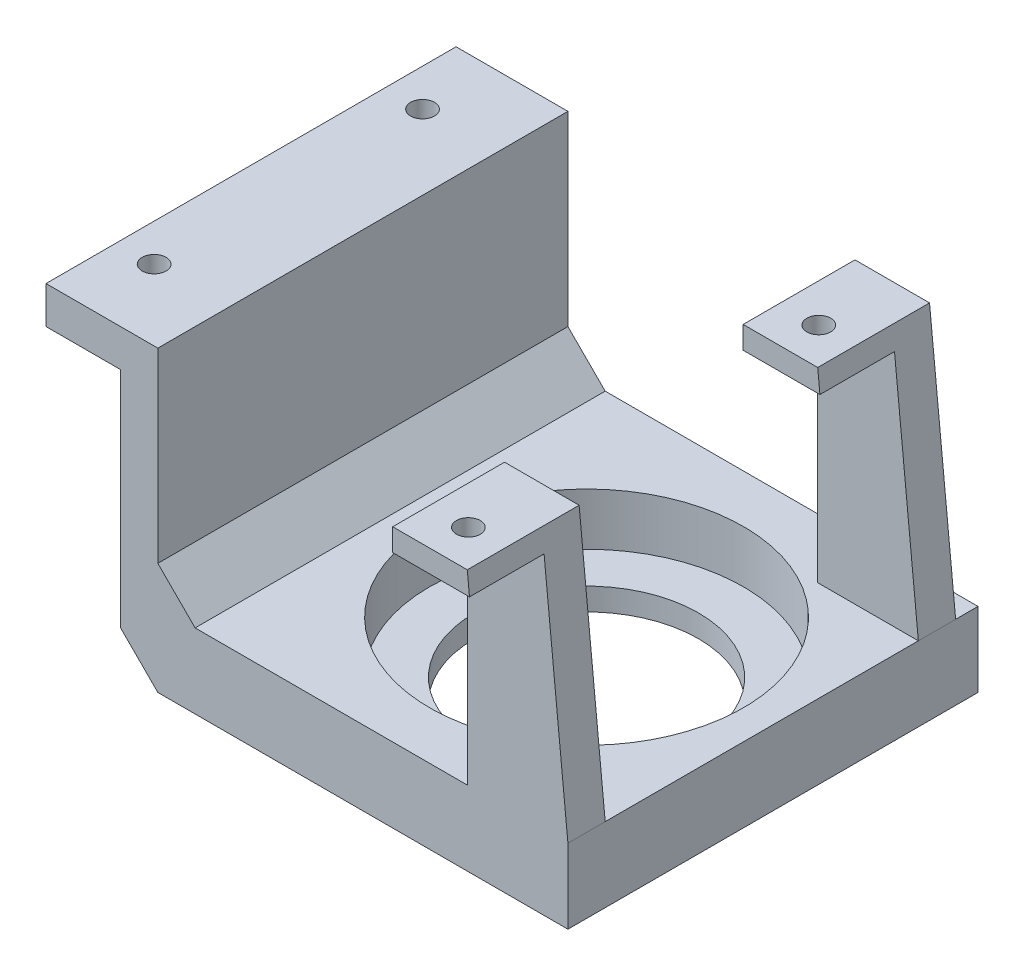
from build123d import *

# Parameters (mm, degrees)
SALIENTE_EXTRUIR2_DEPTH    = 55
CROQUIS6_R                 = 21.05
CORTAR_EXTRUIR1_DEPTH      = 7
CORTAR_EXTRUIR2_DEPTH      = 78.420927403
CORTAR_EXTRUIR2_DEPTH_BACK = 78.420927403
CROQUIS8_R                 = 15
CORTAR_EXTRUIR3_DEPTH      = 77.485292704
CORTAR_EXTRUIR3_DEPTH_BACK = 77.485292704
CROQUIS9_R                 = 1.6
CHAFL_N1_SIZE              = 5
CROQUIS11_W                = 10
CROQUIS11_H                = 5
SALIENTE_EXTRUIR3_DEPTH    = 35
CROQUIS13_W                = 10
CROQUIS13_H                = 5
SALIENTE_EXTRUIR5_DEPTH    = 35
SALIENTE_EXTRUIR7_DEPTH    = 5
SALIENTE_EXTRUIR8_DEPTH    = 5
SALIENTE_EXTRUIR9_DEPTH    = 10
SALIENTE_EXTRUIR10_DEPTH   = 10
CROQUIS15_R                = 1.6
CORTAR_EXTRUIR4_DEPTH      = 88.114866699


with BuildPart() as part:
    # Croquis4 → Saliente-Extruir2 (new body)
    with BuildSketch(Plane.XY):
        Polygon((-30, 5), (-30, 30), (-40, 30), (-40, 35), (-25, 35), (-25, 5), (30, 5), (30, -5), (-30, -5), align=None)
    extrude(amount=SALIENTE_EXTRUIR2_DEPTH)

    # Croquis6 → Cortar-Extruir1 (cut)
    with BuildSketch(Plane(origin=(0, 5, 0), x_dir=(1, 0, 0), z_dir=(0, 1, 0))):
        with Locations((5, -27.5)):
            Circle(CROQUIS6_R)
    extrude(amount=-CORTAR_EXTRUIR1_DEPTH, mode=Mode.SUBTRACT)

    # Croquis8 → Cortar-Extruir2 (cut, two sides: drawn at the far end of the back side and taken through both)
    with BuildSketch(Plane(origin=(0, -2, 0), x_dir=(1, 0, 0), z_dir=(0, 1, 0)).offset(-CORTAR_EXTRUIR2_DEPTH_BACK)):
        with Locations((5, -27.5)):
            Circle(CROQUIS8_R)
    extrude(amount=CORTAR_EXTRUIR2_DEPTH + CORTAR_EXTRUIR2_DEPTH_BACK, mode=Mode.SUBTRACT)

    # Croquis9 → Cortar-Extruir3 (cut, two sides: drawn at the far end of the back side and taken through both)
    with BuildSketch(Plane.XZ.offset(-30).offset(-CORTAR_EXTRUIR3_DEPTH_BACK)):
        with Locations((-35, 45.5)):
            Circle(CROQUIS9_R)
        with Locations((-35, 9.5)):
            Circle(CROQUIS9_R)
    extrude(amount=CORTAR_EXTRUIR3_DEPTH + CORTAR_EXTRUIR3_DEPTH_BACK, mode=Mode.SUBTRACT)

    # Chaflán1
    chafl_n1_edges = [part.edges().sort_by_distance(p)[0] for p in [
        (-25, 5, 27.5),
        (-30, -5, 27.5),
    ]]
    chamfer(chafl_n1_edges, length=CHAFL_N1_SIZE)

    # Croquis11 → Saliente-Extruir3 (add)
    with BuildSketch(Plane(origin=(0, 5, 0), x_dir=(1, 0, 0), z_dir=(0, 1, 0))):
        with Locations((21.5, -52.5)):
            Rectangle(CROQUIS11_W, CROQUIS11_H)
    extrude(amount=SALIENTE_EXTRUIR3_DEPTH)

    # Croquis13 → Saliente-Extruir5 (add)
    with BuildSketch(Plane(origin=(0, 5, 0), x_dir=(1, 0, 0), z_dir=(0, 1, 0))):
        with Locations((21.5, -5.5)):
            Rectangle(CROQUIS13_W, CROQUIS13_H)
    extrude(amount=SALIENTE_EXTRUIR5_DEPTH)

    # Croquis16 → Saliente-Extruir7 (add)
    with BuildSketch(Plane.XY.offset(55)):
        Polygon((30, 5), (26.5, 40), (26.5, 5), align=None)
    extrude(amount=-SALIENTE_EXTRUIR7_DEPTH)

    # Croquis17 → Saliente-Extruir8 (add)
    with BuildSketch(Plane.XY.offset(8)):
        Polygon((30, 5), (26.5, 40), (26.5, 5), align=None)
    extrude(amount=-SALIENTE_EXTRUIR8_DEPTH)

    # Croquis19 → Saliente-Extruir9 (add)
    with BuildSketch(Plane.XY.offset(55)):
        Polygon((16.5, 40), (16.5, 37), (26.8, 37), (26.5, 40), align=None)
    extrude(amount=SALIENTE_EXTRUIR9_DEPTH)

    # Croquis20 → Saliente-Extruir10 (add)
    with BuildSketch(Plane.XY.offset(8)):
        Polygon((16.5, 40), (16.5, 37), (26.8, 37), (26.5, 40), align=None)
    extrude(amount=SALIENTE_EXTRUIR10_DEPTH)

    # Croquis15 → Cortar-Extruir4 (cut, through all)
    with BuildSketch(Plane.XZ.offset(-37)):
        with Locations((21.65, 60)):
            Circle(CROQUIS15_R)
        with Locations((21.65, 13)):
            Circle(CROQUIS15_R)
    extrude(amount=-CORTAR_EXTRUIR4_DEPTH, mode=Mode.SUBTRACT)


solid = part.part
